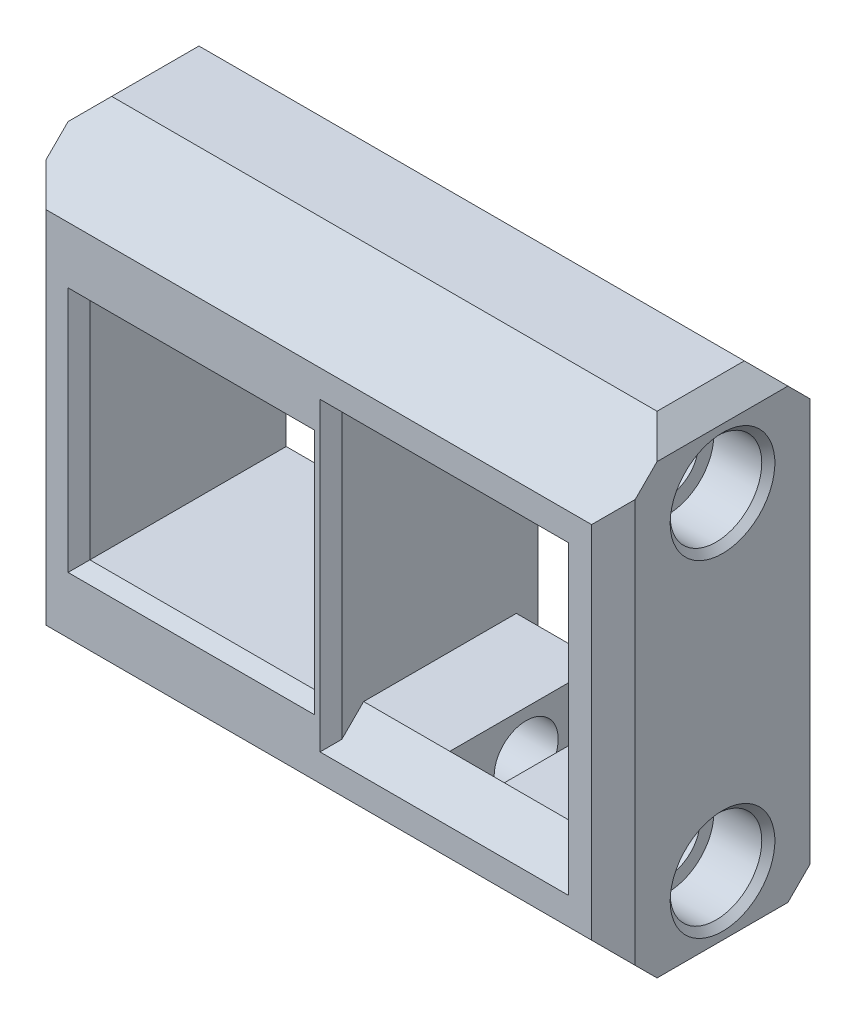
from build123d import *

# Parameters (mm, degrees)
SKETCH1_W           = 68.58
SKETCH1_H           = 57.15
BOSS_EXTRUDE1_DEPTH = 25.4
SKETCH2_W           = 26.162
SKETCH2_H           = 26.162
SKETCH2_W_2         = 26.416
SKETCH2_H_2         = 27.94
CUT_EXTRUDE1_DEPTH  = 93.814324864
SKETCH5_R           = 3.556
SKETCH5_R_2         = 3.729278609
CUT_EXTRUDE2_DEPTH  = 93.814324864
CUT_EXTRUDE3_START  = -16.51
CUT_EXTRUDE3_DEPTH  = 6.35
CHAMFER1_SIZE       = 1.27
CHAMFER2_SIZE       = 2.54
CHAMFER3_SIZE       = 7.62
SKETCH7_R           = 5.334
CUT_EXTRUDE4_DEPTH  = 6.35
CUT_EXTRUDE5_DEPTH  = 7.62
CHAMFER4_SIZE       = 0.762
CHAMFER5_SIZE       = 3.81


with BuildPart() as part:
    # Sketch1 → Boss-Extrude1 (new body)
    with BuildSketch(Plane.XY):
        with Locations((34.29, 28.575)):
            Rectangle(SKETCH1_W, SKETCH1_H)
    extrude(amount=BOSS_EXTRUDE1_DEPTH)

    # Sketch2 → Cut-Extrude1 (cut, through all)
    with BuildSketch(Plane.XY.offset(25.4)):
        with Locations((19.431, 28.575)):
            Rectangle(SKETCH2_W, SKETCH2_H)
        with Locations((48.895, 28.575)):
            Rectangle(SKETCH2_W_2, SKETCH2_H_2)
    extrude(amount=-CUT_EXTRUDE1_DEPTH, mode=Mode.SUBTRACT)

    # Sketch5 → Cut-Extrude2 (cut, through all)
    with BuildSketch(Plane(origin=(68.58, 0, 0), x_dir=(0, 0, -1), z_dir=(1, 0, 0))):
        with Locations((-12.7, 47.625)):
            Circle(SKETCH5_R)
        with Locations((-12.7, 9.525)):
            Circle(SKETCH5_R_2)
    extrude(amount=-CUT_EXTRUDE2_DEPTH, mode=Mode.SUBTRACT)

    # Sketch6 → Cut-Extrude3 (cut)
    with BuildSketch(Plane(origin=(68.58, 0, 0), x_dir=(0, 0, -1), z_dir=(1, 0, 0)).offset(CUT_EXTRUDE3_START)):
        with BuildLine():
            Line((-21.59, 47.625), (-21.59, 12.21272508))
            ThreePointArc((-21.59, 12.21272508), (-15.38772508, 0.635), (-3.81, 6.83727492))
            Line((-3.81, 6.83727492), (-3.81, 47.625))
            ThreePointArc((-3.81, 47.625), (-12.7, 56.515), (-21.59, 47.625))
        make_face()
    extrude(amount=-CUT_EXTRUDE3_DEPTH, mode=Mode.SUBTRACT)

    # Chamfer1
    chamfer1_edges = [part.edges().sort_by_distance(p)[0] for p in [
        (6.35, 28.575, 0),
        (19.431, 41.656, 0),
        (32.512, 28.575, 0),
        (19.431, 15.494, 0),
        (6.35, 28.575, 25.4),
        (19.431, 15.494, 25.4),
        (32.512, 28.575, 25.4),
        (19.431, 41.656, 25.4),
        (35.687, 28.575, 0),
        (62.103, 28.575, 0),
        (35.687, 28.575, 25.4),
        (62.103, 28.575, 25.4),
    ]]
    chamfer(chamfer1_edges, length=CHAMFER1_SIZE)

    # Chamfer2
    chamfer2_edges = [part.edges().sort_by_distance(p)[0] for p in [
        (68.58, 28.575, 25.4),
        (0, 28.575, 25.4),
        (68.58, 28.575, 0),
        (0, 28.575, 0),
        (0, 57.15, 12.7),
        (68.58, 57.15, 12.7),
        (68.58, 0, 12.7),
        (0, 0, 12.7),
    ]]
    chamfer(chamfer2_edges, length=CHAMFER2_SIZE)

    # Chamfer3
    # the kernel refuses this chamfer: 7.62 mm, written as the material it takes off along each edge
    with BuildSketch(Plane(origin=(-17.056224368, 0, 0), x_dir=(0, 1, 0), z_dir=(1, 0, 0)), Plane(origin=(-17.056224368, 0, 25.4), x_dir=(0, 0, -1), z_dir=(1, 0, 0)), Plane(origin=(85.636224368, 57.15, 0), x_dir=(0, -1, 0), z_dir=(-1, 0, 0)), Plane(origin=(85.636224368, 57.15, 25.4), x_dir=(0, 0, -1), z_dir=(-1, 0, 0))) as chamfer3_piece_1:
        Polygon((CHAMFER3_SIZE, 0), (0, CHAMFER3_SIZE), (0, 0), align=None)
    extrude(amount=102.692448737, mode=Mode.SUBTRACT)

    # Sketch7 → Cut-Extrude4 (cut)
    with BuildSketch(Plane(origin=(68.58, 0, 0), x_dir=(0, 0, -1), z_dir=(1, 0, 0))):
        with Locations((-12.7, 47.625)):
            Circle(SKETCH7_R)
        with Locations((-12.7, 9.525)):
            Circle(SKETCH7_R)
    extrude(amount=-CUT_EXTRUDE4_DEPTH, mode=Mode.SUBTRACT)

    # Sketch9 → Cut-Extrude5 (cut)
    with BuildSketch(Plane.ZY):
        Polygon((16.072880273, 53.467), (9.327119727, 53.467), (5.954239455, 47.625), (9.327119727, 41.783), (16.072880273, 41.783), (19.445760545, 47.625), align=None)
        Polygon((16.072880273, 15.367), (9.327119727, 15.367), (5.954239455, 9.525), (9.327119727, 3.683), (16.072880273, 3.683), (19.445760545, 9.525), align=None)
    extrude(amount=-CUT_EXTRUDE5_DEPTH, mode=Mode.SUBTRACT)

    # Chamfer4
    chamfer4_edges = [part.edges().sort_by_distance(p)[0] for p in [
        (68.58, 47.625, 18.034),
        (68.58, 9.525, 18.034),
        (0, 50.546, 17.759320409),
        (0, 53.467, 12.7),
        (0, 50.546, 7.640679591),
        (0, 44.704, 7.640679591),
        (0, 41.783, 12.7),
        (0, 44.704, 17.759320409),
        (0, 12.446, 17.759320409),
        (0, 15.367, 12.7),
        (0, 12.446, 7.640679591),
        (0, 6.604, 7.640679591),
        (0, 3.683, 12.7),
        (0, 6.604, 17.759320409),
    ]]
    chamfer(chamfer4_edges, length=CHAMFER4_SIZE)

    # Chamfer5
    # the kernel refuses this chamfer: 3.81 mm, written as the material it takes off along each edge
    with BuildSketch(Plane(origin=(24.618887816, 14.605, 0), x_dir=(0, -1, 0), z_dir=(1, 0, 0))) as chamfer5_piece_1_section:
        Polygon((CHAMFER5_SIZE, 0), (0, -CHAMFER5_SIZE), (0, 0), align=None)
    chamfer5_piece_1 = extrude(amount=48.552224368, mode=Mode.PRIVATE)
    chamfer5_piece_1 = split(chamfer5_piece_1, bisect_by=Plane(origin=(29.517943908, 14.605, -4.899056092), z_dir=(-0.7071067811865467, 0, 0.7071067811865483)), keep=Keep.TOP, mode=Mode.PRIVATE)
    chamfer5_piece_1 = split(chamfer5_piece_1, bisect_by=Plane(origin=(35.687, 14.605, 0), z_dir=(1, 0, 0)), keep=Keep.TOP, mode=Mode.PRIVATE)
    add(chamfer5_piece_1, mode=Mode.SUBTRACT)
    with BuildSketch(Plane(origin=(24.618887816, 14.605, 0), x_dir=(0, -1, 0), z_dir=(1, 0, 0))) as chamfer5_piece_2_section:
        Polygon((CHAMFER5_SIZE, 0), (0, -CHAMFER5_SIZE), (0, 0), align=None)
    chamfer5_piece_2 = extrude(amount=48.552224368, mode=Mode.PRIVATE)
    chamfer5_piece_2 = split(chamfer5_piece_2, bisect_by=Plane(origin=(29.517943908, 14.605, -4.899056092), z_dir=(0.7071067811865467, 0, -0.7071067811865483)), keep=Keep.TOP, mode=Mode.PRIVATE)
    chamfer5_piece_2 = split(chamfer5_piece_2, bisect_by=Plane(origin=(35.687, 14.605, 0), z_dir=(-1, 0, 0)), keep=Keep.TOP, mode=Mode.PRIVATE)
    add(chamfer5_piece_2, mode=Mode.SUBTRACT)
    with BuildSketch(Plane(origin=(24.618887816, 14.605, 0), x_dir=(0, -1, 0), z_dir=(1, 0, 0))) as chamfer5_piece_3_section:
        Polygon((CHAMFER5_SIZE, 0), (0, -CHAMFER5_SIZE), (0, 0), align=None)
    chamfer5_piece_3 = extrude(amount=48.552224368, mode=Mode.PRIVATE)
    chamfer5_piece_3 = split(chamfer5_piece_3, bisect_by=Plane(origin=(62.103, 14.605, 0), z_dir=(-1, 0, 0)), keep=Keep.TOP, mode=Mode.PRIVATE)
    chamfer5_piece_3 = split(chamfer5_piece_3, bisect_by=Plane(origin=(43.995943908, 14.605, 19.377056092), z_dir=(-0.7071067811865467, 0, -0.7071067811865483)), keep=Keep.TOP, mode=Mode.PRIVATE)
    chamfer5_piece_3 = split(chamfer5_piece_3, bisect_by=Plane(origin=(29.517943908, 14.605, -4.899056092), z_dir=(0.7071067811865467, 0, -0.7071067811865483)), keep=Keep.TOP, mode=Mode.PRIVATE)
    chamfer5_piece_3 = split(chamfer5_piece_3, bisect_by=Plane(origin=(35.687, 14.605, 0), z_dir=(1, 0, 0)), keep=Keep.TOP, mode=Mode.PRIVATE)
    add(chamfer5_piece_3, mode=Mode.SUBTRACT)
    with BuildSketch(Plane(origin=(24.618887816, 14.605, 0), x_dir=(0, -1, 0), z_dir=(1, 0, 0))) as chamfer5_piece_4_section:
        Polygon((CHAMFER5_SIZE, 0), (0, -CHAMFER5_SIZE), (0, 0), align=None)
    chamfer5_piece_4 = extrude(amount=48.552224368, mode=Mode.PRIVATE)
    chamfer5_piece_4 = split(chamfer5_piece_4, bisect_by=Plane(origin=(62.103, 14.605, 0), z_dir=(-1, 0, 0)), keep=Keep.TOP, mode=Mode.PRIVATE)
    chamfer5_piece_4 = split(chamfer5_piece_4, bisect_by=Plane(origin=(43.995943908, 14.605, 19.377056092), z_dir=(0.7071067811865467, 0, 0.7071067811865483)), keep=Keep.TOP, mode=Mode.PRIVATE)
    add(chamfer5_piece_4, mode=Mode.SUBTRACT)
    with BuildSketch(Plane(origin=(24.618887816, 14.605, 0), x_dir=(0, -1, 0), z_dir=(1, 0, 0))) as chamfer5_piece_5_section:
        Polygon((CHAMFER5_SIZE, 0), (0, -CHAMFER5_SIZE), (0, 0), align=None)
    chamfer5_piece_5 = extrude(amount=48.552224368, mode=Mode.PRIVATE)
    chamfer5_piece_5 = split(chamfer5_piece_5, bisect_by=Plane(origin=(62.103, 14.605, 0), z_dir=(1, 0, 0)), keep=Keep.TOP, mode=Mode.PRIVATE)
    chamfer5_piece_5 = split(chamfer5_piece_5, bisect_by=Plane(origin=(43.995943908, 14.605, 19.377056092), z_dir=(-0.7071067811865467, 0, -0.7071067811865483)), keep=Keep.TOP, mode=Mode.PRIVATE)
    add(chamfer5_piece_5, mode=Mode.SUBTRACT)
    with BuildSketch(Plane(origin=(73.171112184, 42.545, 0), x_dir=(0, 1, 0), z_dir=(-1, 0, 0))) as chamfer5_piece_6_section:
        Polygon((CHAMFER5_SIZE, 0), (0, -CHAMFER5_SIZE), (0, 0), align=None)
    chamfer5_piece_6 = extrude(amount=48.552224368, mode=Mode.PRIVATE)
    chamfer5_piece_6 = split(chamfer5_piece_6, bisect_by=Plane(origin=(68.272056092, 42.545, -4.899056092), z_dir=(0.7071067811865467, 0, 0.7071067811865483)), keep=Keep.TOP, mode=Mode.PRIVATE)
    chamfer5_piece_6 = split(chamfer5_piece_6, bisect_by=Plane(origin=(62.103, 42.545, 0), z_dir=(-1, 0, 0)), keep=Keep.TOP, mode=Mode.PRIVATE)
    add(chamfer5_piece_6, mode=Mode.SUBTRACT)
    with BuildSketch(Plane(origin=(73.171112184, 42.545, 0), x_dir=(0, 1, 0), z_dir=(-1, 0, 0))) as chamfer5_piece_7_section:
        Polygon((CHAMFER5_SIZE, 0), (0, -CHAMFER5_SIZE), (0, 0), align=None)
    chamfer5_piece_7 = extrude(amount=48.552224368, mode=Mode.PRIVATE)
    chamfer5_piece_7 = split(chamfer5_piece_7, bisect_by=Plane(origin=(68.272056092, 42.545, -4.899056092), z_dir=(-0.7071067811865467, 0, -0.7071067811865483)), keep=Keep.TOP, mode=Mode.PRIVATE)
    chamfer5_piece_7 = split(chamfer5_piece_7, bisect_by=Plane(origin=(62.103, 42.545, 0), z_dir=(1, 0, 0)), keep=Keep.TOP, mode=Mode.PRIVATE)
    add(chamfer5_piece_7, mode=Mode.SUBTRACT)
    with BuildSketch(Plane(origin=(73.171112184, 42.545, 0), x_dir=(0, 1, 0), z_dir=(-1, 0, 0))) as chamfer5_piece_8_section:
        Polygon((CHAMFER5_SIZE, 0), (0, -CHAMFER5_SIZE), (0, 0), align=None)
    chamfer5_piece_8 = extrude(amount=48.552224368, mode=Mode.PRIVATE)
    chamfer5_piece_8 = split(chamfer5_piece_8, bisect_by=Plane(origin=(35.687, 42.545, 0), z_dir=(1, 0, 0)), keep=Keep.TOP, mode=Mode.PRIVATE)
    chamfer5_piece_8 = split(chamfer5_piece_8, bisect_by=Plane(origin=(53.794056092, 42.545, 19.377056092), z_dir=(0.7071067811865467, 0, -0.7071067811865483)), keep=Keep.TOP, mode=Mode.PRIVATE)
    chamfer5_piece_8 = split(chamfer5_piece_8, bisect_by=Plane(origin=(68.272056092, 42.545, -4.899056092), z_dir=(-0.7071067811865467, 0, -0.7071067811865483)), keep=Keep.TOP, mode=Mode.PRIVATE)
    chamfer5_piece_8 = split(chamfer5_piece_8, bisect_by=Plane(origin=(62.103, 42.545, 0), z_dir=(-1, 0, 0)), keep=Keep.TOP, mode=Mode.PRIVATE)
    add(chamfer5_piece_8, mode=Mode.SUBTRACT)
    with BuildSketch(Plane(origin=(73.171112184, 42.545, 0), x_dir=(0, 1, 0), z_dir=(-1, 0, 0))) as chamfer5_piece_9_section:
        Polygon((CHAMFER5_SIZE, 0), (0, -CHAMFER5_SIZE), (0, 0), align=None)
    chamfer5_piece_9 = extrude(amount=48.552224368, mode=Mode.PRIVATE)
    chamfer5_piece_9 = split(chamfer5_piece_9, bisect_by=Plane(origin=(35.687, 42.545, 0), z_dir=(1, 0, 0)), keep=Keep.TOP, mode=Mode.PRIVATE)
    chamfer5_piece_9 = split(chamfer5_piece_9, bisect_by=Plane(origin=(53.794056092, 42.545, 19.377056092), z_dir=(-0.7071067811865467, 0, 0.7071067811865483)), keep=Keep.TOP, mode=Mode.PRIVATE)
    add(chamfer5_piece_9, mode=Mode.SUBTRACT)
    with BuildSketch(Plane(origin=(73.171112184, 42.545, 0), x_dir=(0, 1, 0), z_dir=(-1, 0, 0))) as chamfer5_piece_10_section:
        Polygon((CHAMFER5_SIZE, 0), (0, -CHAMFER5_SIZE), (0, 0), align=None)
    chamfer5_piece_10 = extrude(amount=48.552224368, mode=Mode.PRIVATE)
    chamfer5_piece_10 = split(chamfer5_piece_10, bisect_by=Plane(origin=(35.687, 42.545, 0), z_dir=(-1, 0, 0)), keep=Keep.TOP, mode=Mode.PRIVATE)
    chamfer5_piece_10 = split(chamfer5_piece_10, bisect_by=Plane(origin=(53.794056092, 42.545, 19.377056092), z_dir=(0.7071067811865467, 0, -0.7071067811865483)), keep=Keep.TOP, mode=Mode.PRIVATE)
    add(chamfer5_piece_10, mode=Mode.SUBTRACT)
    with BuildSketch(Plane(origin=(73.171112184, 42.545, 25.4), x_dir=(0, 1, 0), z_dir=(-1, 0, 0))) as chamfer5_piece_11_section:
        Polygon((CHAMFER5_SIZE, 0), (0, CHAMFER5_SIZE), (0, 0), align=None)
    chamfer5_piece_11 = extrude(amount=48.552224368, mode=Mode.PRIVATE)
    chamfer5_piece_11 = split(chamfer5_piece_11, bisect_by=Plane(origin=(68.272056092, 42.545, 30.299056092), z_dir=(0.7071067811865465, 0, -0.7071067811865486)), keep=Keep.TOP, mode=Mode.PRIVATE)
    chamfer5_piece_11 = split(chamfer5_piece_11, bisect_by=Plane(origin=(62.103, 42.545, 25.4), z_dir=(-1, 0, 0)), keep=Keep.TOP, mode=Mode.PRIVATE)
    add(chamfer5_piece_11, mode=Mode.SUBTRACT)
    with BuildSketch(Plane(origin=(73.171112184, 42.545, 25.4), x_dir=(0, 1, 0), z_dir=(-1, 0, 0))) as chamfer5_piece_12_section:
        Polygon((CHAMFER5_SIZE, 0), (0, CHAMFER5_SIZE), (0, 0), align=None)
    chamfer5_piece_12 = extrude(amount=48.552224368, mode=Mode.PRIVATE)
    chamfer5_piece_12 = split(chamfer5_piece_12, bisect_by=Plane(origin=(68.272056092, 42.545, 30.299056092), z_dir=(-0.7071067811865465, 0, 0.7071067811865486)), keep=Keep.TOP, mode=Mode.PRIVATE)
    chamfer5_piece_12 = split(chamfer5_piece_12, bisect_by=Plane(origin=(62.103, 42.545, 25.4), z_dir=(1, 0, 0)), keep=Keep.TOP, mode=Mode.PRIVATE)
    add(chamfer5_piece_12, mode=Mode.SUBTRACT)
    with BuildSketch(Plane(origin=(73.171112184, 42.545, 25.4), x_dir=(0, 1, 0), z_dir=(-1, 0, 0))) as chamfer5_piece_13_section:
        Polygon((CHAMFER5_SIZE, 0), (0, CHAMFER5_SIZE), (0, 0), align=None)
    chamfer5_piece_13 = extrude(amount=48.552224368, mode=Mode.PRIVATE)
    chamfer5_piece_13 = split(chamfer5_piece_13, bisect_by=Plane(origin=(53.794056092, 42.545, 6.022943908), z_dir=(0.7071067811865465, 0, 0.7071067811865486)), keep=Keep.TOP, mode=Mode.PRIVATE)
    chamfer5_piece_13 = split(chamfer5_piece_13, bisect_by=Plane(origin=(68.272056092, 42.545, 30.299056092), z_dir=(-0.7071067811865465, 0, 0.7071067811865486)), keep=Keep.TOP, mode=Mode.PRIVATE)
    chamfer5_piece_13 = split(chamfer5_piece_13, bisect_by=Plane(origin=(35.687, 42.545, 25.4), z_dir=(1, 0, 0)), keep=Keep.TOP, mode=Mode.PRIVATE)
    chamfer5_piece_13 = split(chamfer5_piece_13, bisect_by=Plane(origin=(62.103, 42.545, 25.4), z_dir=(-1, 0, 0)), keep=Keep.TOP, mode=Mode.PRIVATE)
    add(chamfer5_piece_13, mode=Mode.SUBTRACT)
    with BuildSketch(Plane(origin=(73.171112184, 42.545, 25.4), x_dir=(0, 1, 0), z_dir=(-1, 0, 0))) as chamfer5_piece_14_section:
        Polygon((CHAMFER5_SIZE, 0), (0, CHAMFER5_SIZE), (0, 0), align=None)
    chamfer5_piece_14 = extrude(amount=48.552224368, mode=Mode.PRIVATE)
    chamfer5_piece_14 = split(chamfer5_piece_14, bisect_by=Plane(origin=(53.794056092, 42.545, 6.022943908), z_dir=(-0.7071067811865465, 0, -0.7071067811865486)), keep=Keep.TOP, mode=Mode.PRIVATE)
    chamfer5_piece_14 = split(chamfer5_piece_14, bisect_by=Plane(origin=(35.687, 42.545, 25.4), z_dir=(1, 0, 0)), keep=Keep.TOP, mode=Mode.PRIVATE)
    add(chamfer5_piece_14, mode=Mode.SUBTRACT)
    with BuildSketch(Plane(origin=(73.171112184, 42.545, 25.4), x_dir=(0, 1, 0), z_dir=(-1, 0, 0))) as chamfer5_piece_15_section:
        Polygon((CHAMFER5_SIZE, 0), (0, CHAMFER5_SIZE), (0, 0), align=None)
    chamfer5_piece_15 = extrude(amount=48.552224368, mode=Mode.PRIVATE)
    chamfer5_piece_15 = split(chamfer5_piece_15, bisect_by=Plane(origin=(53.794056092, 42.545, 6.022943908), z_dir=(0.7071067811865465, 0, 0.7071067811865486)), keep=Keep.TOP, mode=Mode.PRIVATE)
    chamfer5_piece_15 = split(chamfer5_piece_15, bisect_by=Plane(origin=(35.687, 42.545, 25.4), z_dir=(-1, 0, 0)), keep=Keep.TOP, mode=Mode.PRIVATE)
    add(chamfer5_piece_15, mode=Mode.SUBTRACT)
    with BuildSketch(Plane(origin=(24.618887816, 14.605, 25.4), x_dir=(0, -1, 0), z_dir=(1, 0, 0))) as chamfer5_piece_16_section:
        Polygon((CHAMFER5_SIZE, 0), (0, CHAMFER5_SIZE), (0, 0), align=None)
    chamfer5_piece_16 = extrude(amount=48.552224368, mode=Mode.PRIVATE)
    chamfer5_piece_16 = split(chamfer5_piece_16, bisect_by=Plane(origin=(35.687, 14.605, 25.4), z_dir=(1, 0, 0)), keep=Keep.TOP, mode=Mode.PRIVATE)
    chamfer5_piece_16 = split(chamfer5_piece_16, bisect_by=Plane(origin=(29.517943908, 14.605, 30.299056092), z_dir=(-0.7071067811865465, 0, -0.7071067811865486)), keep=Keep.TOP, mode=Mode.PRIVATE)
    add(chamfer5_piece_16, mode=Mode.SUBTRACT)
    with BuildSketch(Plane(origin=(24.618887816, 14.605, 25.4), x_dir=(0, -1, 0), z_dir=(1, 0, 0))) as chamfer5_piece_17_section:
        Polygon((CHAMFER5_SIZE, 0), (0, CHAMFER5_SIZE), (0, 0), align=None)
    chamfer5_piece_17 = extrude(amount=48.552224368, mode=Mode.PRIVATE)
    chamfer5_piece_17 = split(chamfer5_piece_17, bisect_by=Plane(origin=(35.687, 14.605, 25.4), z_dir=(-1, 0, 0)), keep=Keep.TOP, mode=Mode.PRIVATE)
    chamfer5_piece_17 = split(chamfer5_piece_17, bisect_by=Plane(origin=(29.517943908, 14.605, 30.299056092), z_dir=(0.7071067811865465, 0, 0.7071067811865486)), keep=Keep.TOP, mode=Mode.PRIVATE)
    add(chamfer5_piece_17, mode=Mode.SUBTRACT)
    with BuildSketch(Plane(origin=(24.618887816, 14.605, 25.4), x_dir=(0, -1, 0), z_dir=(1, 0, 0))) as chamfer5_piece_18_section:
        Polygon((CHAMFER5_SIZE, 0), (0, CHAMFER5_SIZE), (0, 0), align=None)
    chamfer5_piece_18 = extrude(amount=48.552224368, mode=Mode.PRIVATE)
    chamfer5_piece_18 = split(chamfer5_piece_18, bisect_by=Plane(origin=(62.103, 14.605, 25.4), z_dir=(-1, 0, 0)), keep=Keep.TOP, mode=Mode.PRIVATE)
    chamfer5_piece_18 = split(chamfer5_piece_18, bisect_by=Plane(origin=(35.687, 14.605, 25.4), z_dir=(1, 0, 0)), keep=Keep.TOP, mode=Mode.PRIVATE)
    chamfer5_piece_18 = split(chamfer5_piece_18, bisect_by=Plane(origin=(29.517943908, 14.605, 30.299056092), z_dir=(0.7071067811865465, 0, 0.7071067811865486)), keep=Keep.TOP, mode=Mode.PRIVATE)
    chamfer5_piece_18 = split(chamfer5_piece_18, bisect_by=Plane(origin=(43.995943908, 14.605, 6.022943908), z_dir=(-0.7071067811865465, 0, 0.7071067811865486)), keep=Keep.TOP, mode=Mode.PRIVATE)
    add(chamfer5_piece_18, mode=Mode.SUBTRACT)
    with BuildSketch(Plane(origin=(24.618887816, 14.605, 25.4), x_dir=(0, -1, 0), z_dir=(1, 0, 0))) as chamfer5_piece_19_section:
        Polygon((CHAMFER5_SIZE, 0), (0, CHAMFER5_SIZE), (0, 0), align=None)
    chamfer5_piece_19 = extrude(amount=48.552224368, mode=Mode.PRIVATE)
    chamfer5_piece_19 = split(chamfer5_piece_19, bisect_by=Plane(origin=(62.103, 14.605, 25.4), z_dir=(-1, 0, 0)), keep=Keep.TOP, mode=Mode.PRIVATE)
    chamfer5_piece_19 = split(chamfer5_piece_19, bisect_by=Plane(origin=(43.995943908, 14.605, 6.022943908), z_dir=(0.7071067811865465, 0, -0.7071067811865486)), keep=Keep.TOP, mode=Mode.PRIVATE)
    add(chamfer5_piece_19, mode=Mode.SUBTRACT)
    with BuildSketch(Plane(origin=(24.618887816, 14.605, 25.4), x_dir=(0, -1, 0), z_dir=(1, 0, 0))) as chamfer5_piece_20_section:
        Polygon((CHAMFER5_SIZE, 0), (0, CHAMFER5_SIZE), (0, 0), align=None)
    chamfer5_piece_20 = extrude(amount=48.552224368, mode=Mode.PRIVATE)
    chamfer5_piece_20 = split(chamfer5_piece_20, bisect_by=Plane(origin=(62.103, 14.605, 25.4), z_dir=(1, 0, 0)), keep=Keep.TOP, mode=Mode.PRIVATE)
    chamfer5_piece_20 = split(chamfer5_piece_20, bisect_by=Plane(origin=(43.995943908, 14.605, 6.022943908), z_dir=(-0.7071067811865465, 0, 0.7071067811865486)), keep=Keep.TOP, mode=Mode.PRIVATE)
    add(chamfer5_piece_20, mode=Mode.SUBTRACT)


solid = part.part
